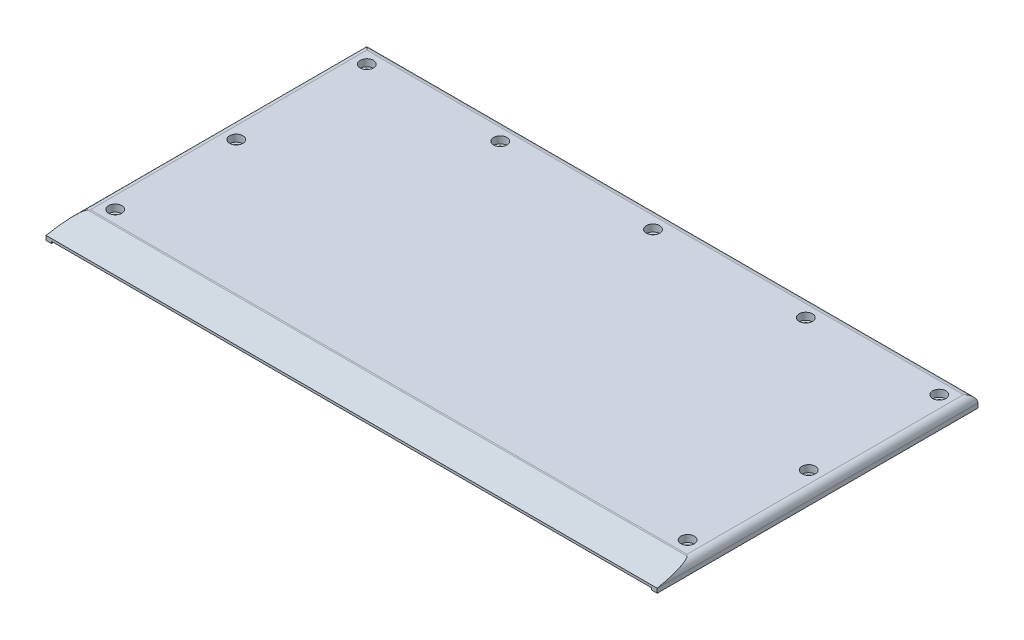
from build123d import *

# Parameters (mm, degrees)
SKETCH1_W           = 247.82
SKETCH1_H           = 120.12
SKETCH1_R           = 1.6
SKETCH1_H_2         = 10.57
SKETCH1_H_3         = 1.8
BOSS_EXTRUDE1_DEPTH = 4
SKETCH1_5_W         = 247.82
SKETCH1_5_H         = 1.8
BOSS_EXTRUDE2_DEPTH = 0.8
SKETCH1_6_W         = 247.82
SKETCH1_6_H         = 10.57
BOSS_EXTRUDE3_DEPTH = 1.4
SKETCH2_R           = 2.75
CUT_EXTRUDE1_DEPTH  = 2.9
CUT_EXTRUDE2_REACH  = 287.106
FILLET1_R           = 3


with BuildPart() as part:
    # Sketch1 → Boss-Extrude1 (new body)
    # profile 1 of 5: a face of its own
    with BuildSketch(Plane(origin=(0, 0, 0), x_dir=(1, 0, 0), z_dir=(0, 1, 0))):
        with Locations((126.21, -61.86)):
            Rectangle(SKETCH1_W, SKETCH1_H)
        with Locations(Location((8, -111.92, 0), (0, 0, 270))):
            Circle(SKETCH1_R, mode=Mode.SUBTRACT)
        with Locations(Location((244.42, -111.92, 0), (0, 0, 270))):
            Circle(SKETCH1_R, mode=Mode.SUBTRACT)
        with Locations(Location((8, -61.92, 0), (0, 0, 270))):
            Circle(SKETCH1_R, mode=Mode.SUBTRACT)
        with Locations(Location((8, -8, 0), (0, 0, 270))):
            Circle(SKETCH1_R, mode=Mode.SUBTRACT)
        with Locations(Location((63.11, -8, 0), (0, 0, 270))):
            Circle(SKETCH1_R, mode=Mode.SUBTRACT)
        with Locations(Location((244.42, -61.92, 0), (0, 0, 270))):
            Circle(SKETCH1_R, mode=Mode.SUBTRACT)
        with Locations(Location((126.21, -8, 0), (0, 0, 270))):
            Circle(SKETCH1_R, mode=Mode.SUBTRACT)
        with Locations(Location((189.31, -8, 0), (0, 0, 270))):
            Circle(SKETCH1_R, mode=Mode.SUBTRACT)
        with Locations(Location((244.42, -8, 0), (0, 0, 270))):
            Circle(SKETCH1_R, mode=Mode.SUBTRACT)
    # profile 2 of 5: a face of its own
    with BuildSketch(Plane(origin=(0, 0, 0), x_dir=(1, 0, 0), z_dir=(0, 1, 0))):
        Polygon((252.42, 0), (250.12, 0), (250.12, -1.8), (250.12, -121.92), (250.12, -132.49), (252.42, -132.49), align=None)
    # profile 3 of 5: a face of its own
    with BuildSketch(Plane(origin=(0, 0, 0), x_dir=(1, 0, 0), z_dir=(0, 1, 0))):
        with Locations((126.21, -127.205)):
            Rectangle(SKETCH1_W, SKETCH1_H_2)
    # profile 4 of 5: a face of its own
    with BuildSketch(Plane(origin=(0, 0, 0), x_dir=(1, 0, 0), z_dir=(0, 1, 0))):
        Polygon((2.3, 0), (0, 0), (0, -132.49), (2.3, -132.49), (2.3, -121.92), (2.3, -1.8), align=None)
    # profile 5 of 5: a face of its own
    with BuildSketch(Plane(origin=(0, 0, 0), x_dir=(1, 0, 0), z_dir=(0, 1, 0))):
        with Locations((126.21, -0.9)):
            Rectangle(SKETCH1_W, SKETCH1_H_3)
    extrude(amount=BOSS_EXTRUDE1_DEPTH)

    # Sketch1<5> → Boss-Extrude2 (add)
    with BuildSketch(Plane(origin=(0, 0, 0), x_dir=(1, 0, 0), z_dir=(0, 1, 0))):
        Polygon((2.3, 0), (0, 0), (0, -132.49), (2.3, -132.49), (2.3, -121.92), (2.3, -1.8), align=None)
        with Locations((126.21, -0.9)):
            Rectangle(SKETCH1_5_W, SKETCH1_5_H)
        Polygon((252.42, 0), (250.12, 0), (250.12, -1.8), (250.12, -121.92), (250.12, -132.49), (252.42, -132.49), align=None)
    extrude(amount=-BOSS_EXTRUDE2_DEPTH)

    # Sketch1<6> → Boss-Extrude3 (add)
    with BuildSketch(Plane(origin=(0, 0, 0), x_dir=(1, 0, 0), z_dir=(0, 1, 0))):
        with Locations((126.21, -127.205)):
            Rectangle(SKETCH1_6_W, SKETCH1_6_H)
    extrude(amount=BOSS_EXTRUDE3_DEPTH)

    # Sketch2 → Cut-Extrude1 (cut)
    with BuildSketch(Plane(origin=(0, 4, 0), x_dir=(1, 0, 0), z_dir=(0, 1, 0))):
        with Locations(Location((8, -8, 0), (0, 0, 270))):
            Circle(SKETCH2_R)
        with Locations(Location((63.11, -8, 0), (0, 0, 270))):
            Circle(SKETCH2_R)
        with Locations(Location((126.21, -8, 0), (0, 0, 270))):
            Circle(SKETCH2_R)
        with Locations(Location((189.31, -8, 0), (0, 0, 270))):
            Circle(SKETCH2_R)
        with Locations(Location((244.42, -8, 0), (0, 0, 270))):
            Circle(SKETCH2_R)
        with Locations(Location((244.42, -61.92, 0), (0, 0, 270))):
            Circle(SKETCH2_R)
        with Locations(Location((244.42, -111.92, 0), (0, 0, 270))):
            Circle(SKETCH2_R)
        with Locations(Location((8, -111.92, 0), (0, 0, 270))):
            Circle(SKETCH2_R)
        with Locations(Location((8, -61.92, 0), (0, 0, 270))):
            Circle(SKETCH2_R)
    extrude(amount=-CUT_EXTRUDE1_DEPTH, mode=Mode.SUBTRACT)

    # Sketch3 → Cut-Extrude2 (cut, up to next)
    with BuildSketch(Plane.ZY, mode=Mode.PRIVATE) as cut_extrude2_sk1:
        Polygon((117.49, 4), (132.49, 1), (132.49, 4), align=None)
    cut_extrude2_tool1 = extrude(cut_extrude2_sk1.sketch, amount=-CUT_EXTRUDE2_REACH, mode=Mode.PRIVATE) & part.part
    add(cut_extrude2_tool1.solids().sort_by_distance((0, 3, 127.49))[0], mode=Mode.SUBTRACT)

    # Fillet1
    fillet1_edges = [part.edges().sort_by_distance(p)[0] for p in [
        (0, 4, 58.745),
        (126.21, 4, 0),
        (126.21, 4, 117.49),
        (252.42, 4, 58.745),
    ]]
    fillet(fillet1_edges, radius=FILLET1_R - 0.0001)  # a hair under: the kernel refuses the full size


solid = part.part
